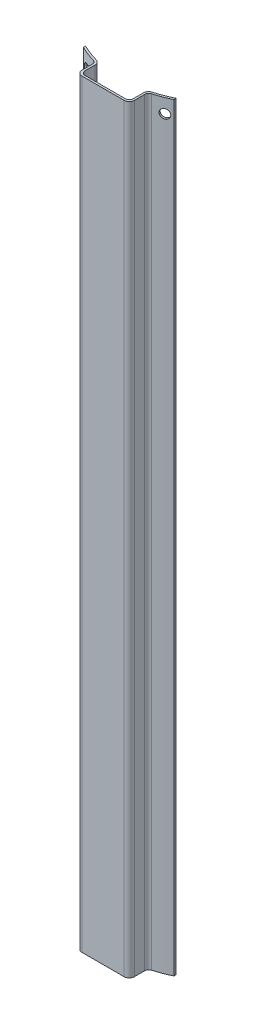
from build123d import *

# Parameters (mm, degrees)
EXTRUDE_1_DEPTH = 15
FILLET_1_R      = 2
FILLET_2_R      = 2.5
EXTRUDE_2_DEPTH = 362


# Read off the part's stored shape, not the designer's step: Отверстие с зазором M41
with BuildPart() as part:
    # Эскиз1 → Бобышка-Вытянуть1 (new body)
    with BuildSketch(Plane(origin=(0, 0, 0), x_dir=(1, 0, 0), z_dir=(0, 1, 0))):
        with BuildLine():
            Line((-22.5, -46.880166382), (-22.5, -45.768438907))
            ThreePointArc((-22.5, -45.768438907), (-17.354305588, -47.956522784), (-12, -49.568134926))
            Line((-12, -49.568134926), (-12, -58.568134926))
            Line((-12, -58.568134926), (12, -58.568134926))
            Line((12, -58.568134926), (12, -49.568134926))
            ThreePointArc((12, -49.568134926), (17.354305588, -47.956522784), (22.5, -45.768438907))
            Line((22.5, -45.768438907), (22.5, -46.880166382))
            ThreePointArc((22.5, -46.880166382), (17.834526239, -48.845979096), (13, -50.348783501))
            Line((13, -50.348783501), (13, -59.568134926))
            Line((13, -59.568134926), (-13, -59.568134926))
            Line((-13, -59.568134926), (-13, -50.348783501))
            ThreePointArc((-13, -50.348783501), (-17.834526239, -48.845979096), (-22.5, -46.880166382))
        make_face()
    extrude(amount=EXTRUDE_1_DEPTH)

    # Скругление1
    fillet_1_edges = [part.edges().sort_by_distance(p)[0] for p in [
        (-13, 7.5, 50.348783501),
        (13, 7.5, 50.348783501),
        (12, 7.5, 58.568134926),
        (-12, 7.5, 58.568134926),
    ]]
    fillet(fillet_1_edges, radius=FILLET_1_R)

    # Скругление2
    fillet_2_edges = [part.edges().sort_by_distance(p)[0] for p in [
        (-12, 7.5, 49.568134926),
        (-13, 7.5, 59.568134926),
        (13, 7.5, 59.568134926),
        (12, 7.5, 49.568134926),
    ]]
    fillet(fillet_2_edges, radius=FILLET_2_R)

    # Отверстие с зазором M41 outline → Отверстие с зазором M41 (revolve, cut)
    with BuildSketch(Plane(origin=(0, 8, 0), x_dir=(0.9280125149960182, 0, -0.37254901960784303), z_dir=(0, -1, 0))):
        Polygon((2.25, 52.000021479), (2.25, 51.975), (2.275021479, 52.000021479), align=None)
        Polygon((2.25, 50.950316764), (2.25, 51.975), (2.25, 52.000021479), (0, 52.000021479), (0, 50.950316764), align=None)
    revolve(axis=Axis((0, 8, 0), (0.37254901960784303, 0, 0.9280125149960182)), mode=Mode.SUBTRACT)

    # Hole Wizard M41 2 outline → Hole Wizard M41 2 (revolve, cut)
    with BuildSketch(Plane(origin=(0, 8, 0), x_dir=(0.9280125149960182, 0, 0.37254901960784303), z_dir=(0, 1, 0))):
        Polygon((2.25, -52.000019282), (2.25, -51.975), (2.25, -50.950316764), (0, -50.950316764), (0, -52.000019282), align=None)
        Polygon((2.275019282, -52.000019282), (2.249998249, -51.974998249), (2.25, -52.000019282), align=None)
    revolve(axis=Axis((0, 8, 0), (0.37254901960784303, 0, -0.9280125149960182)), mode=Mode.SUBTRACT)

    # Эскиз3 → Бобышка-Вытянуть2 (add)
    with BuildSketch(Plane.XZ):
        with BuildLine():
            Line((12, 56.568134926), (12, 51.497572758))
            ThreePointArc((12, 51.497572758), (12.507021672, 49.988255899), (13.822429907, 49.091144125))
            ThreePointArc((13.822429907, 49.091144125), (18.237045294, 47.627829878), (22.5, 45.768438907))
            Line((22.5, 45.768438907), (22.5, 46.880166382))
            ThreePointArc((22.5, 46.880166382), (18.536030559, 48.584108216), (14.444444444, 49.953558679))
            ThreePointArc((14.444444444, 49.953558679), (13.401389492, 50.672998972), (13, 51.874849397))
            Line((13, 51.874849397), (13, 57.068134926))
            ThreePointArc((13, 57.068134926), (12.267766953, 58.835901879), (10.5, 59.568134926))
            Line((10.5, 59.568134926), (-10.5, 59.568134926))
            ThreePointArc((-10.5, 59.568134926), (-12.267766953, 58.835901879), (-13, 57.068134926))
            Line((-13, 57.068134926), (-13, 51.874849397))
            ThreePointArc((-13, 51.874849397), (-13.401389492, 50.672998972), (-14.444444444, 49.953558679))
            ThreePointArc((-14.444444444, 49.953558679), (-18.536030559, 48.584108216), (-22.5, 46.880166382))
            Line((-22.5, 46.880166382), (-22.5, 45.768438907))
            ThreePointArc((-22.5, 45.768438907), (-18.237045294, 47.627829878), (-13.822429907, 49.091144125))
            ThreePointArc((-13.822429907, 49.091144125), (-12.507021672, 49.988255899), (-12, 51.497572758))
            Line((-12, 51.497572758), (-12, 56.568134926))
            ThreePointArc((-12, 56.568134926), (-11.414213562, 57.982348488), (-10, 58.568134926))
            Line((-10, 58.568134926), (10, 58.568134926))
            ThreePointArc((10, 58.568134926), (11.414213562, 57.982348488), (12, 56.568134926))
        make_face()
    extrude(amount=EXTRUDE_2_DEPTH)


solid = part.part
